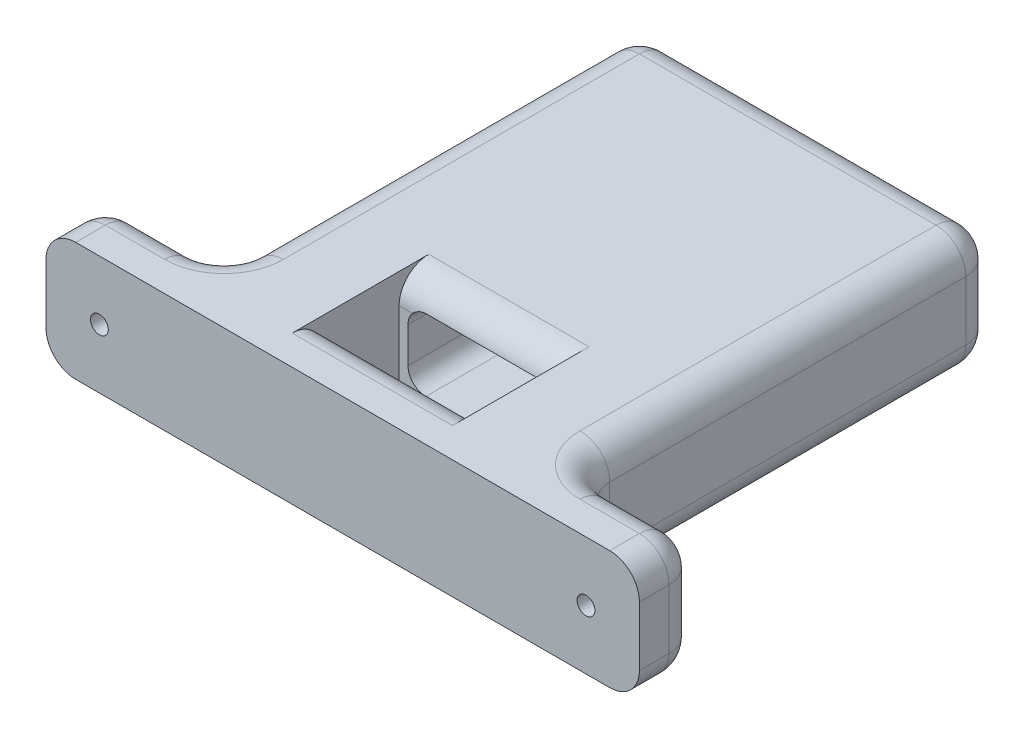
from build123d import *

# Parameters (mm, degrees)
ESBO_O1_W                = 60
ESBO_O1_H                = 20
RESSALTO_EXTRUS_O1_DEPTH = 80
ESBO_O4_W                = 27
ESBO_O4_H                = 13
CORTE_EXTRUS_O2_DEPTH    = 125.196330299
ESBO_O6_W                = 10
ESBO_O6_H                = 20
RESSALTO_EXTRUS_O2_DEPTH = 20
ESBO_O5_W                = 10
ESBO_O5_H                = 20
RESSALTO_EXTRUS_O3_DEPTH = 20
CORTE_EXTRUS_O4_REACH    = 143.168
FILETE1_R                = 5
ESBO_O8_R                = 1.5
CORTE_EXTRUS_O5_DEPTH    = 136.751531604
FILETE2_R                = 5


with BuildPart() as part:
    # Esboço1 → Ressalto-extrusão1 (new body)
    with BuildSketch(Plane.XY):
        with Locations((-62.86941617, -18.088666872)):
            Rectangle(ESBO_O1_W, ESBO_O1_H)
    extrude(amount=RESSALTO_EXTRUS_O1_DEPTH)

    # Esboço4 → Corte-extrusão2 (cut, through all)
    with BuildSketch(Plane(origin=(0, -28.088666872, 0), x_dir=(-1, 0, 0), z_dir=(0, -1, 0))):
        with Locations((62.86941617, -63.5)):
            Rectangle(ESBO_O4_W, ESBO_O4_H)
    extrude(amount=-CORTE_EXTRUS_O2_DEPTH, mode=Mode.SUBTRACT)

    # Esboço6 → Ressalto-extrusão2 (add)
    with BuildSketch(Plane.ZY.offset(92.86941617)):
        with Locations((75, -18.088666872)):
            Rectangle(ESBO_O6_W, ESBO_O6_H)
    extrude(amount=RESSALTO_EXTRUS_O2_DEPTH)

    # Esboço5 → Ressalto-extrusão3 (add)
    with BuildSketch(Plane(origin=(-32.86941617, 0, 0), x_dir=(0, 0, -1), z_dir=(1, 0, 0))):
        with Locations((-75, -18.088666872)):
            Rectangle(ESBO_O5_W, ESBO_O5_H)
    extrude(amount=RESSALTO_EXTRUS_O3_DEPTH)

    # Esboço7 → Corte-extrusão4 (cut, up to next)
    with BuildSketch(Plane(origin=(0, 0, 0), x_dir=(-1, 0, 0), z_dir=(0, 0, -1)), mode=Mode.PRIVATE) as corte_extrus_o4_sk1:
        with BuildLine():
            Line((71.86941617, -24.088666872), (53.86941617, -24.088666872))
            ThreePointArc((53.86941617, -24.088666872), (51.748095827, -23.209987216), (50.86941617, -21.088666872))
            Line((50.86941617, -21.088666872), (50.86941617, -15.088666872))
            ThreePointArc((50.86941617, -15.088666872), (51.748095827, -12.967346529), (53.86941617, -12.088666872))
            Line((53.86941617, -12.088666872), (71.86941617, -12.088666872))
            ThreePointArc((71.86941617, -12.088666872), (73.990736514, -12.967346529), (74.86941617, -15.088666872))
            Line((74.86941617, -15.088666872), (74.86941617, -21.088666872))
            ThreePointArc((74.86941617, -21.088666872), (73.990736514, -23.209987216), (71.86941617, -24.088666872))
        make_face()
    corte_extrus_o4_tool1 = extrude(corte_extrus_o4_sk1.sketch, amount=-CORTE_EXTRUS_O4_REACH, mode=Mode.PRIVATE) & part.part
    add(corte_extrus_o4_tool1.solids().sort_by_distance((-62.869416, -18.088667, 0))[0], mode=Mode.SUBTRACT)

    # Filete1
    # the kernel refuses this fillet: 5 mm, written as the material it adds along each edge
    with BuildSketch(Plane(origin=(-92.86941617, -28.088666872, 70), x_dir=(0, 0, -1), z_dir=(0, 1, 0)), Plane(origin=(-32.86941617, -28.088666872, 70), x_dir=(1, 0, 0), z_dir=(0, 1, 0))) as filete1_piece_1:
        with BuildLine():
            CenterArc((FILETE1_R, FILETE1_R), FILETE1_R, 180, 90)
            Line((0, FILETE1_R), (0, 0))
            Line((0, 0), (FILETE1_R, 0))
        make_face()
    extrude(amount=20)
    # the kernel refuses this fillet: 5 mm, written as the material it takes off along each edge
    with BuildSketch(Plane(origin=(-12.86941617, -8.088666872, 57.5), x_dir=(0, -1, 0), z_dir=(0, 0, 1)), Plane(origin=(-112.86941617, -28.088666872, 92.5), x_dir=(1, 0, 0), z_dir=(0, 0, -1))) as filete1_2_piece_1:
        with BuildLine():
            CenterArc((FILETE1_R, -FILETE1_R), FILETE1_R, 90, 90)
            Line((0, -FILETE1_R), (0, 0))
            Line((0, 0), (FILETE1_R, 0))
        make_face()
    extrude(amount=35, mode=Mode.SUBTRACT)
    with BuildSketch(Plane(origin=(-112.86941617, -8.088666872, 57.5), x_dir=(0, -1, 0), z_dir=(0, 0, 1)), Plane(origin=(-12.86941617, -28.088666872, 92.5), x_dir=(-1, 0, 0), z_dir=(0, 0, -1))) as filete1_2_piece_2:
        with BuildLine():
            CenterArc((FILETE1_R, FILETE1_R), FILETE1_R, 180, 90)
            Line((0, FILETE1_R), (0, 0))
            Line((0, 0), (FILETE1_R, 0))
        make_face()
    extrude(amount=35, mode=Mode.SUBTRACT)
    with BuildSketch(Plane(origin=(-112.86941617, -40.588666872, 70), x_dir=(1, 0, 0), z_dir=(0, 1, 0)), Plane(origin=(-12.86941617, -40.588666872, 70), x_dir=(0, 0, 1), z_dir=(0, 1, 0)), Plane(origin=(-92.86941617, 4.411333128, 0), x_dir=(0, 0, 1), z_dir=(0, -1, 0)), Plane(origin=(-32.86941617, -40.588666872, 0), x_dir=(0, 0, 1), z_dir=(0, 1, 0))) as filete1_2_piece_3:
        with BuildLine():
            CenterArc((FILETE1_R, -FILETE1_R), FILETE1_R, 90, 90)
            Line((0, -FILETE1_R), (0, 0))
            Line((0, 0), (FILETE1_R, 0))
        make_face()
    extrude(amount=45, mode=Mode.SUBTRACT)
    with BuildSketch(Plane(origin=(-105.36941617, -28.088666872, 0), x_dir=(0, 0, 1), z_dir=(1, 0, 0))) as filete1_2_piece_4:
        with BuildLine():
            CenterArc((FILETE1_R, -FILETE1_R), FILETE1_R, 90, 90)
            Line((0, -FILETE1_R), (0, 0))
            Line((0, 0), (FILETE1_R, 0))
        make_face()
    extrude(amount=85, mode=Mode.SUBTRACT)
    with BuildSketch(Plane(origin=(-20.36941617, -8.088666872, 0), x_dir=(0, -1, 0), z_dir=(-1, 0, 0))) as filete1_2_piece_5:
        with BuildLine():
            CenterArc((FILETE1_R, FILETE1_R), FILETE1_R, 180, 90)
            Line((0, FILETE1_R), (0, 0))
            Line((0, 0), (FILETE1_R, 0))
        make_face()
    extrude(amount=85, mode=Mode.SUBTRACT)
    # the kernel refuses this fillet: 5 mm, written as the material it takes off along each edge
    with BuildSketch(Plane(origin=(-87.86941617, -23.088666872, 5), x_dir=(-1, 0, 0), z_dir=(0, -1, 0))) as filete1_3_piece_1_section:
        Polygon((0, 0), (FILETE1_R, 0), (FILETE1_R, FILETE1_R), (0, FILETE1_R), align=None)
    filete1_3_piece_1 = extrude(amount=FILETE1_R, mode=Mode.PRIVATE)
    filete1_3_piece_1 = filete1_3_piece_1 - Plane(origin=(-87.86941617, -23.088666872, 5), x_dir=(0.7071067811865475, 0, 0.7071067811865475), z_dir=(0, -1, 0)) * Sphere(FILETE1_R, mode=Mode.PRIVATE)
    add(filete1_3_piece_1, mode=Mode.SUBTRACT)
    with BuildSketch(Plane(origin=(-87.86941617, -13.088666872, 5), x_dir=(0, 1, 0), z_dir=(-1, 0, 0))) as filete1_3_piece_2_section:
        Polygon((0, 0), (FILETE1_R, 0), (FILETE1_R, FILETE1_R), (0, FILETE1_R), align=None)
    filete1_3_piece_2 = extrude(amount=FILETE1_R, mode=Mode.PRIVATE)
    filete1_3_piece_2 = filete1_3_piece_2 - Plane(origin=(-87.86941617, -13.088666872, 5), x_dir=(0, -0.7071067811865475, 0.7071067811865475), z_dir=(-1, 0, 0)) * Sphere(FILETE1_R, mode=Mode.PRIVATE)
    add(filete1_3_piece_2, mode=Mode.SUBTRACT)
    with BuildSketch(Plane(origin=(-37.86941617, -13.088666872, 5), x_dir=(0, 1, 0), z_dir=(1, 0, 0))) as filete1_3_piece_3_section:
        Polygon((0, 0), (FILETE1_R, 0), (FILETE1_R, -FILETE1_R), (0, -FILETE1_R), align=None)
    filete1_3_piece_3 = extrude(amount=FILETE1_R, mode=Mode.PRIVATE)
    filete1_3_piece_3 = filete1_3_piece_3 - Plane(origin=(-37.86941617, -13.088666872, 5), x_dir=(0, -0.7071067811865475, 0.7071067811865475), z_dir=(1, 0, 0)) * Sphere(FILETE1_R, mode=Mode.PRIVATE)
    add(filete1_3_piece_3, mode=Mode.SUBTRACT)
    with BuildSketch(Plane(origin=(-37.86941617, -23.088666872, 5), x_dir=(1, 0, 0), z_dir=(0, -1, 0))) as filete1_3_piece_4_section:
        Polygon((0, 0), (FILETE1_R, 0), (FILETE1_R, -FILETE1_R), (0, -FILETE1_R), align=None)
    filete1_3_piece_4 = extrude(amount=FILETE1_R, mode=Mode.PRIVATE)
    filete1_3_piece_4 = filete1_3_piece_4 - Plane(origin=(-37.86941617, -23.088666872, 5), x_dir=(-0.7071067811865475, 0, 0.7071067811865475), z_dir=(0, -1, 0)) * Sphere(FILETE1_R, mode=Mode.PRIVATE)
    add(filete1_3_piece_4, mode=Mode.SUBTRACT)
    with BuildSketch(Plane(origin=(-107.86941617, -23.088666872, 75), x_dir=(0, 0, -1), z_dir=(0, -1, 0))) as filete1_3_piece_5_section:
        Polygon((0, 0), (FILETE1_R, 0), (FILETE1_R, -FILETE1_R), (0, -FILETE1_R), align=None)
    filete1_3_piece_5 = extrude(amount=FILETE1_R, mode=Mode.PRIVATE)
    filete1_3_piece_5 = filete1_3_piece_5 - Plane(origin=(-107.86941617, -23.088666872, 75), x_dir=(0.7071067811865475, 0, 0.7071067811865475), z_dir=(0, -1, 0)) * Sphere(FILETE1_R, mode=Mode.PRIVATE)
    add(filete1_3_piece_5, mode=Mode.SUBTRACT)
    with BuildSketch(Plane(origin=(-17.86941617, -13.088666872, 75), x_dir=(0, 1, 0), z_dir=(0, 0, -1))) as filete1_3_piece_6_section:
        Polygon((0, 0), (FILETE1_R, 0), (FILETE1_R, FILETE1_R), (0, FILETE1_R), align=None)
    filete1_3_piece_6 = extrude(amount=FILETE1_R, mode=Mode.PRIVATE)
    filete1_3_piece_6 = filete1_3_piece_6 - Plane(origin=(-17.86941617, -13.088666872, 75), x_dir=(-0.7071067811865475, -0.7071067811865475, 0), z_dir=(0, 0, -1)) * Sphere(FILETE1_R, mode=Mode.PRIVATE)
    add(filete1_3_piece_6, mode=Mode.SUBTRACT)
    with BuildSketch(Plane(origin=(-17.86941617, -23.088666872, 75), x_dir=(0, 0, -1), z_dir=(0, -1, 0))) as filete1_3_piece_7_section:
        Polygon((0, 0), (FILETE1_R, 0), (FILETE1_R, FILETE1_R), (0, FILETE1_R), align=None)
    filete1_3_piece_7 = extrude(amount=FILETE1_R, mode=Mode.PRIVATE)
    filete1_3_piece_7 = filete1_3_piece_7 - Plane(origin=(-17.86941617, -23.088666872, 75), x_dir=(-0.7071067811865475, 0, 0.7071067811865475), z_dir=(0, -1, 0)) * Sphere(FILETE1_R, mode=Mode.PRIVATE)
    add(filete1_3_piece_7, mode=Mode.SUBTRACT)
    with BuildSketch(Plane(origin=(-107.86941617, -13.088666872, 75), x_dir=(0, 1, 0), z_dir=(0, 0, -1))) as filete1_3_piece_8_section:
        Polygon((0, 0), (FILETE1_R, 0), (FILETE1_R, -FILETE1_R), (0, -FILETE1_R), align=None)
    filete1_3_piece_8 = extrude(amount=FILETE1_R, mode=Mode.PRIVATE)
    filete1_3_piece_8 = filete1_3_piece_8 - Plane(origin=(-107.86941617, -13.088666872, 75), x_dir=(0.7071067811865475, -0.7071067811865475, 0), z_dir=(0, 0, -1)) * Sphere(FILETE1_R, mode=Mode.PRIVATE)
    add(filete1_3_piece_8, mode=Mode.SUBTRACT)
    with BuildSketch(Plane(origin=(-97.86941617, -8.088666872, 70), x_dir=(0, -1, 0), z_dir=(-1, 0, 0)), Plane(origin=(-97.86941617, -28.088666872, 70), x_dir=(0, 0, 1), z_dir=(-1, 0, 0))) as filete1_3_piece_9:
        with BuildLine():
            CenterArc((FILETE1_R, FILETE1_R), FILETE1_R, 180, 90)
            Line((0, FILETE1_R), (0, 0))
            Line((0, 0), (FILETE1_R, 0))
        make_face()
    extrude(amount=10, mode=Mode.SUBTRACT)
    with BuildSketch(Plane(origin=(-27.86941617, -28.088666872, 70), x_dir=(0, 0, 1), z_dir=(1, 0, 0)), Plane(origin=(-27.86941617, -8.088666872, 70), x_dir=(0, -1, 0), z_dir=(1, 0, 0))) as filete1_3_piece_10:
        with BuildLine():
            CenterArc((FILETE1_R, -FILETE1_R), FILETE1_R, 90, 90)
            Line((0, -FILETE1_R), (0, 0))
            Line((0, 0), (FILETE1_R, 0))
        make_face()
    extrude(amount=10, mode=Mode.SUBTRACT)
    with BuildSketch(Plane(origin=(-32.86941617, -28.088666872, 5), x_dir=(-1, 0, 0), z_dir=(0, 0, 1)), Plane(origin=(-32.86941617, -8.088666872, 5), x_dir=(0, -1, 0), z_dir=(0, 0, 1))) as filete1_3_piece_11:
        with BuildLine():
            CenterArc((FILETE1_R, -FILETE1_R), FILETE1_R, 90, 90)
            Line((0, -FILETE1_R), (0, 0))
            Line((0, 0), (FILETE1_R, 0))
        make_face()
    extrude(amount=60, mode=Mode.SUBTRACT)
    with BuildSketch(Plane(origin=(-92.86941617, -8.088666872, 5), x_dir=(0, -1, 0), z_dir=(0, 0, 1)), Plane(origin=(-92.86941617, -28.088666872, 5), x_dir=(1, 0, 0), z_dir=(0, 0, 1))) as filete1_3_piece_12:
        with BuildLine():
            CenterArc((FILETE1_R, FILETE1_R), FILETE1_R, 180, 90)
            Line((0, FILETE1_R), (0, 0))
            Line((0, 0), (FILETE1_R, 0))
        make_face()
    extrude(amount=60, mode=Mode.SUBTRACT)
    with BuildSketch(Plane(origin=(-97.86941617, -28.088666872, 65), x_dir=(1, 0, 0), z_dir=(0, 0, -1))) as filete1_3_piece_13:
        with BuildLine():
            CenterArc((5 + FILETE1_R, -FILETE1_R), FILETE1_R, 90, 90)
            Line((5, -FILETE1_R), (5, 0))
            Line((5, 0), (5 + FILETE1_R, 0))
        make_face()
    revolve(axis=Axis((-97.86941617, -28.088666872, 65), (0, -1, 0)), revolution_arc=90, mode=Mode.SUBTRACT)
    with BuildSketch(Plane(origin=(-97.86941617, -8.088666872, 65), x_dir=(1, 0, 0), z_dir=(0, 0, -1))) as filete1_3_piece_14:
        with BuildLine():
            CenterArc((5 + FILETE1_R, FILETE1_R), FILETE1_R, 180, 90)
            Line((5 + FILETE1_R, 0), (5, 0))
            Line((5, 0), (5, FILETE1_R))
        make_face()
    revolve(axis=Axis((-97.86941617, -8.088666872, 65), (0, -1, 0)), revolution_arc=90, mode=Mode.SUBTRACT)
    with BuildSketch(Plane(origin=(-27.86941617, -8.088666872, 65), x_dir=(0, 0, 1), z_dir=(1, 0, 0))) as filete1_3_piece_15:
        with BuildLine():
            CenterArc((5 + FILETE1_R, FILETE1_R), FILETE1_R, 180, 90)
            Line((5 + FILETE1_R, 0), (5, 0))
            Line((5, 0), (5, FILETE1_R))
        make_face()
    revolve(axis=Axis((-27.86941617, -8.088666872, 65), (0, -1, 0)), revolution_arc=90, mode=Mode.SUBTRACT)
    with BuildSketch(Plane(origin=(-27.86941617, -28.088666872, 65), x_dir=(0, 0, 1), z_dir=(1, 0, 0))) as filete1_3_piece_16:
        with BuildLine():
            CenterArc((5 + FILETE1_R, -FILETE1_R), FILETE1_R, 90, 90)
            Line((5, -FILETE1_R), (5, 0))
            Line((5, 0), (5 + FILETE1_R, 0))
        make_face()
    revolve(axis=Axis((-27.86941617, -28.088666872, 65), (0, -1, 0)), revolution_arc=90, mode=Mode.SUBTRACT)

    # Esboço8 → Corte-extrusão5 (cut, through all)
    with BuildSketch(Plane(origin=(0, 0, 70), x_dir=(-1, 0, 0), z_dir=(0, 0, -1))):
        with Locations((21.86941617, -18.088666872)):
            Circle(ESBO_O8_R)
        with Locations((103.86941617, -18.088666872)):
            Circle(ESBO_O8_R)
    extrude(amount=-CORTE_EXTRUS_O5_DEPTH, mode=Mode.SUBTRACT)

    # Filete2
    # the kernel refuses this fillet: 5 mm, written as the material it takes off along each edge
    with BuildSketch(Plane(origin=(-49.36941617, -8.088666872, 70), x_dir=(0, 0, 1), z_dir=(-1, 0, 0)), Plane(origin=(-76.36941617, -8.088666872, 57), x_dir=(0, 0, -1), z_dir=(1, 0, 0))) as filete2_piece_1:
        with BuildLine():
            CenterArc((FILETE2_R, -FILETE2_R), FILETE2_R, 90, 90)
            Line((0, -FILETE2_R), (0, 0))
            Line((0, 0), (FILETE2_R, 0))
        make_face()
    extrude(amount=27, mode=Mode.SUBTRACT)


solid = part.part
